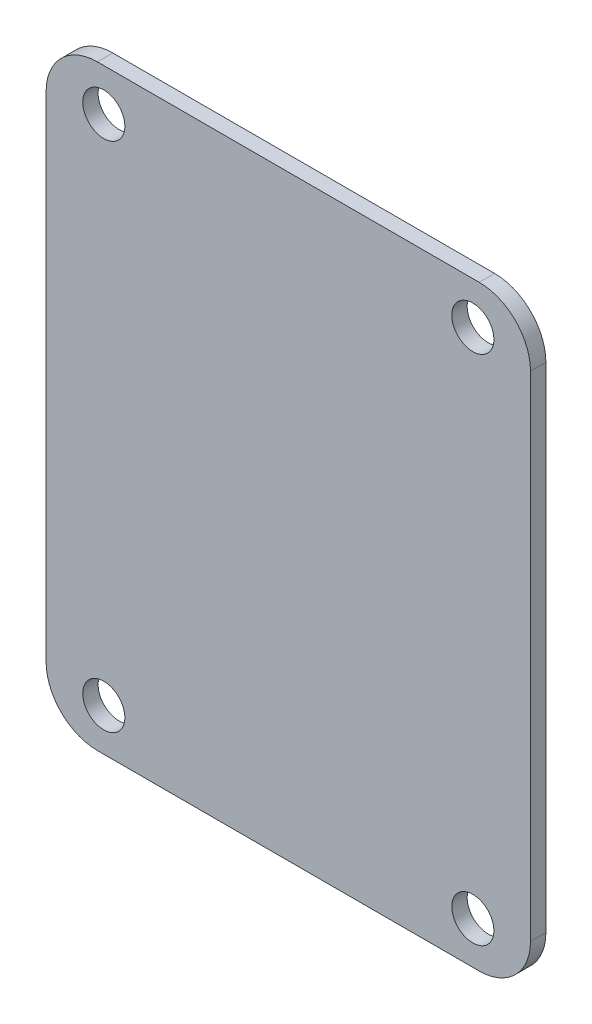
from build123d import *

# Parameters (mm, degrees)
SKETCH1_R           = 1.04267733
BOSS_EXTRUDE1_DEPTH = 0.762


with BuildPart() as part:
    # Sketch1 → Boss-Extrude1 (new body)
    with BuildSketch(Plane.XY):
        with BuildLine():
            Line((12.100363965, 4.486555478), (12.100363965, -19.973555079))
            ThreePointArc((12.100363965, -19.973555079), (11.35641519, -21.769606303), (9.560363965, -22.513555079))
            Line((9.560363965, -22.513555079), (-9.348625644, -22.513555079))
            ThreePointArc((-9.348625644, -22.513555079), (-11.144676868, -21.769606303), (-11.888625644, -19.973555079))
            Line((-11.888625644, -19.973555079), (-11.888625644, 4.486555478))
            ThreePointArc((-11.888625644, 4.486555478), (-11.144676868, 6.282606702), (-9.348625644, 7.026555478))
            Line((-9.348625644, 7.026555478), (9.560363965, 7.026555478))
            ThreePointArc((9.560363965, 7.026555478), (11.35641519, 6.282606702), (12.100363965, 4.486555478))
        make_face()
        with Locations((-9.032869923, 4.937406726)):
            Circle(SKETCH1_R, mode=Mode.SUBTRACT)
        with Locations((9.244608245, 4.937406726)):
            Circle(SKETCH1_R, mode=Mode.SUBTRACT)
        with Locations((9.244608245, -20.424406327)):
            Circle(SKETCH1_R, mode=Mode.SUBTRACT)
        with Locations((-9.032869923, -20.424406327)):
            Circle(SKETCH1_R, mode=Mode.SUBTRACT)
    extrude(amount=BOSS_EXTRUDE1_DEPTH)


solid = part.part
